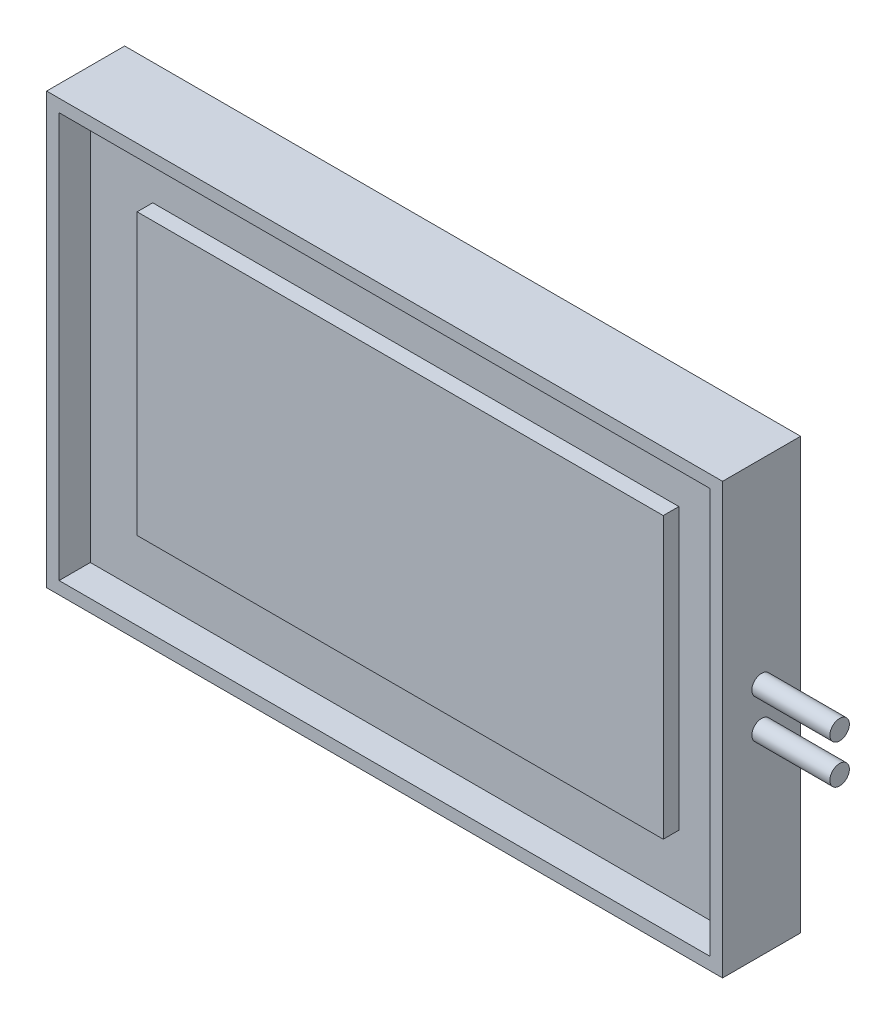
from build123d import *

# Parameters (mm, degrees)
SKETCH1_W           = 55
SKETCH1_H           = 35
BOSS_EXTRUDE1_DEPTH = 6.35
SKETCH2_R           = 0.79375
BOSS_EXTRUDE2_DEPTH = 6.35
SKETCH4_R           = 1.587499993
CUT_EXTRUDE2_DEPTH  = 0.254
SKETCH5_W           = 52.968
SKETCH5_H           = 32.968
CUT_EXTRUDE3_DEPTH  = 2.54
SKETCH6_W           = 42.808
SKETCH6_H           = 22.808
BOSS_EXTRUDE3_DEPTH = 1.27


with BuildPart() as part:
    # Sketch1 → Boss-Extrude1 (new body)
    with BuildSketch(Plane.XY):
        with Locations((-56.246376812, 16.09057971)):
            Rectangle(SKETCH1_W, SKETCH1_H)
    extrude(amount=BOSS_EXTRUDE1_DEPTH)

    # Sketch2 → Boss-Extrude2 (add)
    with BuildSketch(Plane(origin=(-28.746376812, 0, 0), x_dir=(0, 0, -1), z_dir=(1, 0, 0))):
        with Locations((-3.175, 17.67807971)):
            Circle(SKETCH2_R)
        with Locations((-3.175, 14.50307971)):
            Circle(SKETCH2_R)
    extrude(amount=BOSS_EXTRUDE2_DEPTH)

    # Sketch4 → Cut-Extrude2 (cut)
    with BuildSketch(Plane(origin=(0, 0, 0), x_dir=(-1, 0, 0), z_dir=(0, 0, -1))):
        with Locations((56.246376812, 16.09057971)):
            Circle(SKETCH4_R)
    extrude(amount=-CUT_EXTRUDE2_DEPTH, mode=Mode.SUBTRACT)

    # Sketch5 → Cut-Extrude3 (cut)
    with BuildSketch(Plane.XY.offset(6.35)):
        with Locations((-56.246376812, 16.09057971)):
            Rectangle(SKETCH5_W, SKETCH5_H)
    extrude(amount=-CUT_EXTRUDE3_DEPTH, mode=Mode.SUBTRACT)

    # Sketch6 → Boss-Extrude3 (add)
    with BuildSketch(Plane.XY.offset(3.81)):
        with Locations((-56.246376812, 16.09057971)):
            Rectangle(SKETCH6_W, SKETCH6_H)
    extrude(amount=BOSS_EXTRUDE3_DEPTH)


solid = part.part
